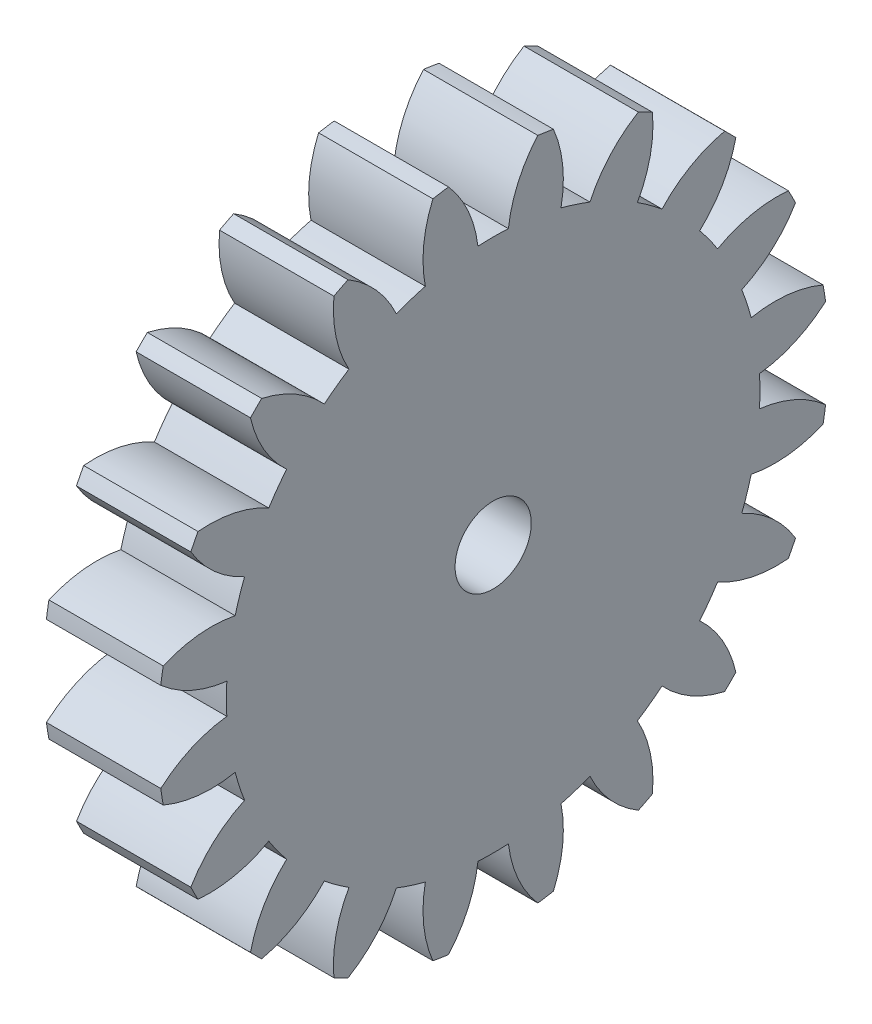
from build123d import *

# Parameters (mm, degrees)
BASPROSKE_W     = 19.05
BASPROSKE_H     = 55.88
TOOTHCUT_DEPTH  = 82.289921269
TEETHCUTS_COUNT = 20
TEETHCUTS_ANGLE = 342
BORSKE_R        = 6.35
BORE_DEPTH      = 50.8000508


with BuildPart() as part:
    # BasProSke → Base-Revolve (revolve)
    with BuildSketch(Plane(origin=(0, 0, 0), x_dir=(1, 0, 0), z_dir=(0, 1, 0))):
        with Locations((9.525, 27.94)):
            Rectangle(BASPROSKE_W, BASPROSKE_H)
    revolve(axis=Axis((-10, 0, 0), (1, 0, 0)))

    # TooCutSke → ToothCut (cut, through all)
    with BuildSketch(Plane(origin=(0, 0, 0), x_dir=(0, 0, -1), z_dir=(1, 0, 0))):
        with BuildLine():
            ThreePointArc((2.536170045, 44.376316207), (0, 44.44873), (-2.536170045, 44.376316207))
            ThreePointArc((-2.536170045, 44.376316207), (-4.158326974, 50.265126028), (-7.45725115, 55.405804339))
            ThreePointArc((-7.45725115, 55.405804339), (0, 55.9054), (7.45725115, 55.405804339))
            ThreePointArc((7.45725115, 55.405804339), (4.158326974, 50.265126028), (2.536170045, 44.376316207))
        make_face()
    toothcut = extrude(amount=TOOTHCUT_DEPTH, mode=Mode.SUBTRACT)

    # TeethCuts: ToothCut ×20 about axis
    teethcuts_axis = Axis((-10, 0, 0), (1, 0, 0))
    for i in range(1, TEETHCUTS_COUNT):
        add(toothcut.rotate(teethcuts_axis, i * TEETHCUTS_ANGLE / (TEETHCUTS_COUNT - 1)), mode=Mode.SUBTRACT)

    # BorSke → Bore (cut, symmetric)
    with BuildSketch(Plane(origin=(0, 0, 0), x_dir=(0, 0, -1), z_dir=(1, 0, 0))):
        Circle(BORSKE_R)
    extrude(amount=BORE_DEPTH, both=True, mode=Mode.SUBTRACT)


solid = part.part
